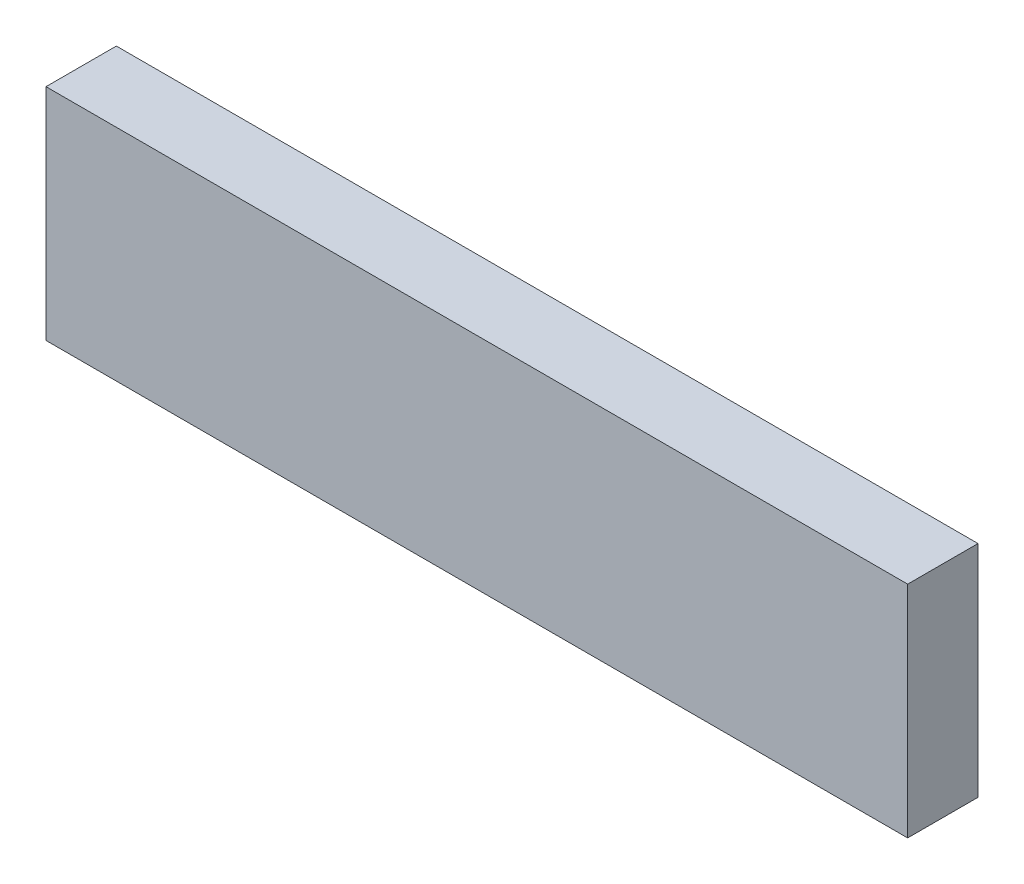
from build123d import *

# Parameters (mm, degrees)
SKETCH1_W           = 311.15
SKETCH1_H           = 25.4
BOSS_EXTRUDE1_DEPTH = 39.6875


with BuildPart() as part:
    # Sketch1 → Boss-Extrude1 (new, symmetric)
    with BuildSketch(Plane(origin=(0, 0, 0), x_dir=(1, 0, 0), z_dir=(0, 1, 0))):
        Rectangle(SKETCH1_W, SKETCH1_H)
    extrude(amount=BOSS_EXTRUDE1_DEPTH, both=True)


solid = part.part
